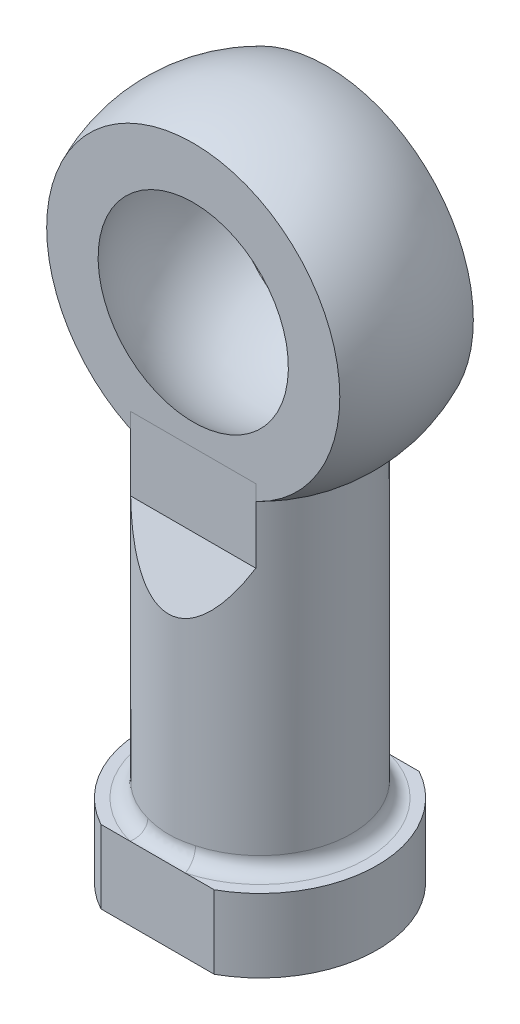
from build123d import *

# Parameters (mm, degrees)
EXTRUDE2_DEPTH          = 3
EXTRUDE2_DEPTH_BACK     = 25
SKETCH5_R               = 6.25
SKETCH5_R_2             = 3.4
SKETCH7_R               = 3.4
BOSS_EXTRUDE1_DEPTH     = 5
FILLET1_R               = 1
CUT_EXTRUDE1_DEPTH      = 39.28837955
CUT_EXTRUDE1_DEPTH_BACK = 39.28837955


with BuildPart() as part:
    # Sketch3 → Revolve2 (revolve)
    with BuildSketch(Plane(origin=(0, 0, 0), x_dir=(0, 0, -1), z_dir=(1, 0, 0))):
        with BuildLine():
            Line((-4.56, 10.01031468), (-4.56, 0))
            Line((-4.56, 0), (4.56, 0))
            Line((4.56, 0), (4.56, 10.01031468))
            ThreePointArc((4.56, 10.01031468), (0, 11), (-4.56, 10.01031468))
        make_face()
    revolve(axis=Axis((0, 0, 8.146649187), (0, 0, -1)))

    # Sketch2 → Cut-Revolve2 (revolve, cut)
    with BuildSketch(Plane(origin=(0, 0, 0), x_dir=(0, 0, -1), z_dir=(1, 0, 0))):
        with BuildLine():
            Line((0, 7.938), (0, -7.938))
            ThreePointArc((0, -7.938), (7.938, 0), (0, 7.938))
        make_face()
    revolve(axis=Axis((0, 15.474361319, 0), (0, -1, 0)), mode=Mode.SUBTRACT)


with BuildPart() as body_2:
    # Sketch5 → Extrude2 (new, two sides: drawn at the far end of the back side and taken through both)
    with BuildSketch(Plane(origin=(0, -11, 0), x_dir=(-1, 0, 0), z_dir=(0, 1, 0)).offset(-EXTRUDE2_DEPTH_BACK)):
        Circle(SKETCH5_R)
        Circle(SKETCH5_R_2, mode=Mode.SUBTRACT)
    extrude(amount=EXTRUDE2_DEPTH + EXTRUDE2_DEPTH_BACK)

    # Sketch7 → Boss-Extrude1 (add)
    with BuildSketch(Plane.XZ.offset(36)):
        with BuildLine():
            Line((-3.872983346, 7), (3.872983346, 7))
            ThreePointArc((3.872983346, 7), (8, 0), (3.872983346, -7))
            Line((3.872983346, -7), (-3.872983346, -7))
            ThreePointArc((-3.872983346, -7), (-8, 0), (-3.872983346, 7))
        make_face()
        Circle(SKETCH7_R, mode=Mode.SUBTRACT)
    extrude(amount=-BOSS_EXTRUDE1_DEPTH)

    # Fillet1
    fillet1_edges = [body_2.edges().sort_by_distance(p)[0] for p in [
        (6.25, -31, 0),
    ]]
    fillet(fillet1_edges, radius=FILLET1_R)

    # Sketch8 → Cut-Extrude1 (cut, two sides: drawn at the far end of the back side and taken through both)
    with BuildSketch(Plane(origin=(0, 0, 0), x_dir=(0, 0, -1), z_dir=(1, 0, 0)).offset(-CUT_EXTRUDE1_DEPTH_BACK)):
        Polygon((-4.56, 0), (-4.56, -13), (-6.25, -17), (-14.338899791, -17), (-14.338899791, 16.981131473), (14.338899791, 16.981131473), (14.338899791, -17), (6.25, -17), (4.56, -13), (4.56, 0), (4.56, 14.718656898), (-4.56, 14.718656898), align=None)
    extrude(amount=CUT_EXTRUDE1_DEPTH + CUT_EXTRUDE1_DEPTH_BACK, mode=Mode.SUBTRACT)


solid = Compound([part.part, body_2.part])
